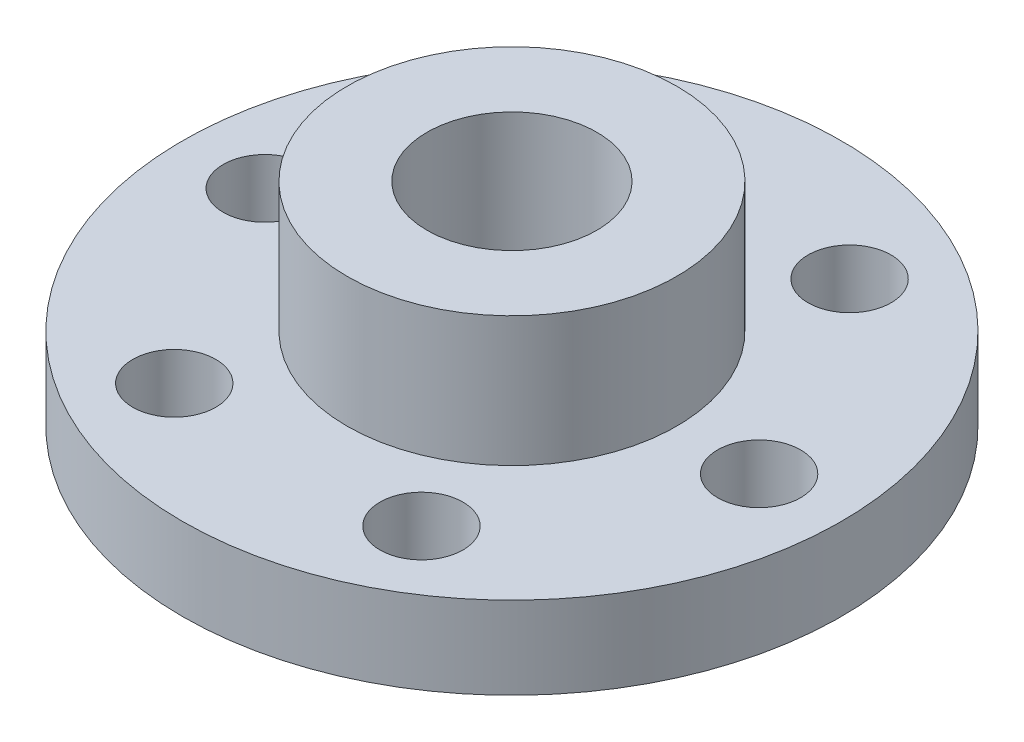
from build123d import *

# Parameters (mm, degrees)
SKETCH1_R            = 25.4
SKETCH1_R_2          = 4.826
BOSS_EXTRUDE1_DEPTH  = 6.35
SKETCH2_R            = 12.7
SKETCH2_R_2          = 6.5484375
BOSS_EXTRUDE2_DEPTH  = 10.000000066
M6_CLEARANCE_HOLE1_D = 6.4


with BuildPart() as part:
    # Sketch1 → Boss-Extrude1 (new body)
    with BuildSketch(Plane(origin=(0, 0, 0), x_dir=(1, 0, 0), z_dir=(0, 1, 0))):
        Circle(SKETCH1_R)
        Circle(SKETCH1_R_2, mode=Mode.SUBTRACT)
    extrude(amount=BOSS_EXTRUDE1_DEPTH)

    # Sketch2 → Boss-Extrude2 (add)
    with BuildSketch(Plane(origin=(0, 6.35, 0), x_dir=(1, 0, 0), z_dir=(0, 1, 0))):
        Circle(SKETCH2_R)
        Circle(SKETCH2_R_2, mode=Mode.SUBTRACT)
    extrude(amount=BOSS_EXTRUDE2_DEPTH)

    # M6 Clearance Hole1 (through all)
    with Locations(Plane(origin=(0, 6.35, 0), x_dir=(1, 0, 0), z_dir=(0, 1, 0))):
        with Locations((-19.05, 0), (-9.525, 16.497783942), (9.525, 16.497783942), (19.05, 0), (9.525, -16.497783942), (-9.525, -16.497783942), (0, 0)):
            Hole(M6_CLEARANCE_HOLE1_D / 2)


solid = part.part
